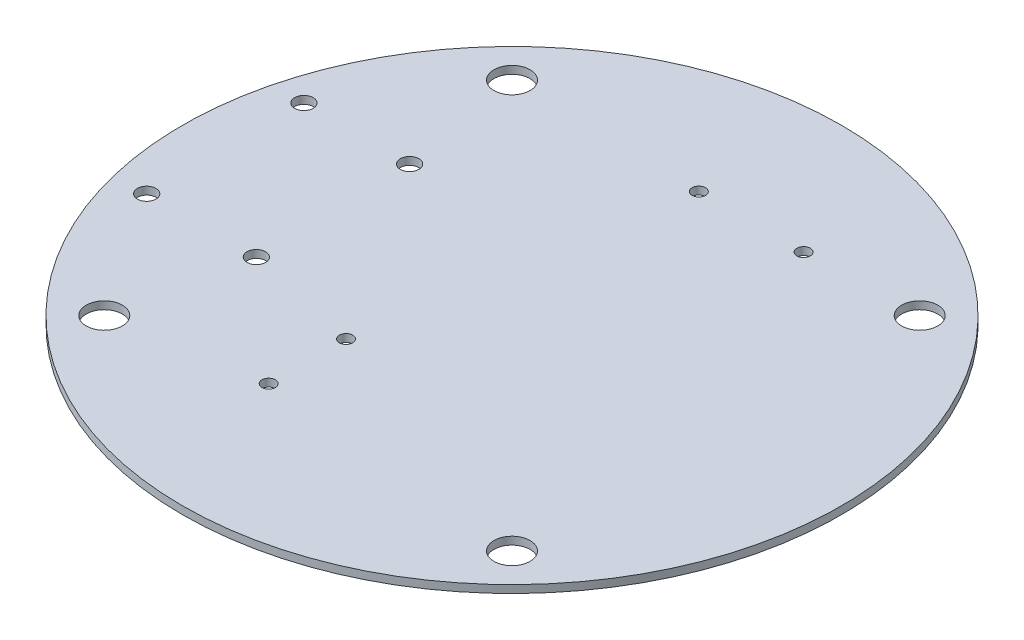
from build123d import *

# Parameters (mm, degrees)
SKETCH1_R            = 63.9
BOSS_EXTRUDE1_DEPTH  = 1.5
M6_CLEARANCE_HOLE1_D = 7
CIRPATTERN1_COUNT    = 4
M2_CLEARANCE_HOLE1_D = 2.6
M3_CLEARANCE_HOLE2_D = 3.6


with BuildPart() as part:
    # Sketch1 → Boss-Extrude1 (new body)
    with BuildSketch(Plane(origin=(0, 0, 0), x_dir=(1, 0, 0), z_dir=(0, 1, 0))):
        Circle(SKETCH1_R)
    extrude(amount=BOSS_EXTRUDE1_DEPTH)

    # M6 Clearance Hole1 (through all)
    with Locations(Plane(origin=(0, 1.5, 0), x_dir=(1, 0, 0), z_dir=(0, 1, 0))):
        with Locations((-39.527269068, -39.527269068)):
            m6_clearance_hole1 = Hole(M6_CLEARANCE_HOLE1_D / 2)

    # CirPattern1: M6 Clearance Hole1 ×4 about axis
    cirpattern1_axis = Axis((0, 1.5, 0), (0, -1, 0))
    for i in range(1, CIRPATTERN1_COUNT):
        add(m6_clearance_hole1.rotate(cirpattern1_axis, i * 360 / CIRPATTERN1_COUNT), mode=Mode.SUBTRACT)

    # M2 Clearance Hole1 (through all)
    with Locations(Plane(origin=(0, 1.5, 0), x_dir=(1, 0, 0), z_dir=(0, 1, 0))):
        with Locations((-2.709999951, 38.930000111), (17.610000128, 38.930000136), (-12.154, -20.027269068), (-12.154, -35.027269068)):
            Hole(M2_CLEARANCE_HOLE1_D / 2)

    # M3 Clearance Hole2 (through all)
    with Locations(Plane(origin=(0, 1.5, 0), x_dir=(1, 0, 0), z_dir=(0, 1, 0))):
        with Locations((-55.86454119, 15.511690642), (-55.864546519, -14.968309358), (-34.604546519, -14.968313075), (-35.36654119, 15.511687058)):
            Hole(M3_CLEARANCE_HOLE2_D / 2)


solid = part.part
